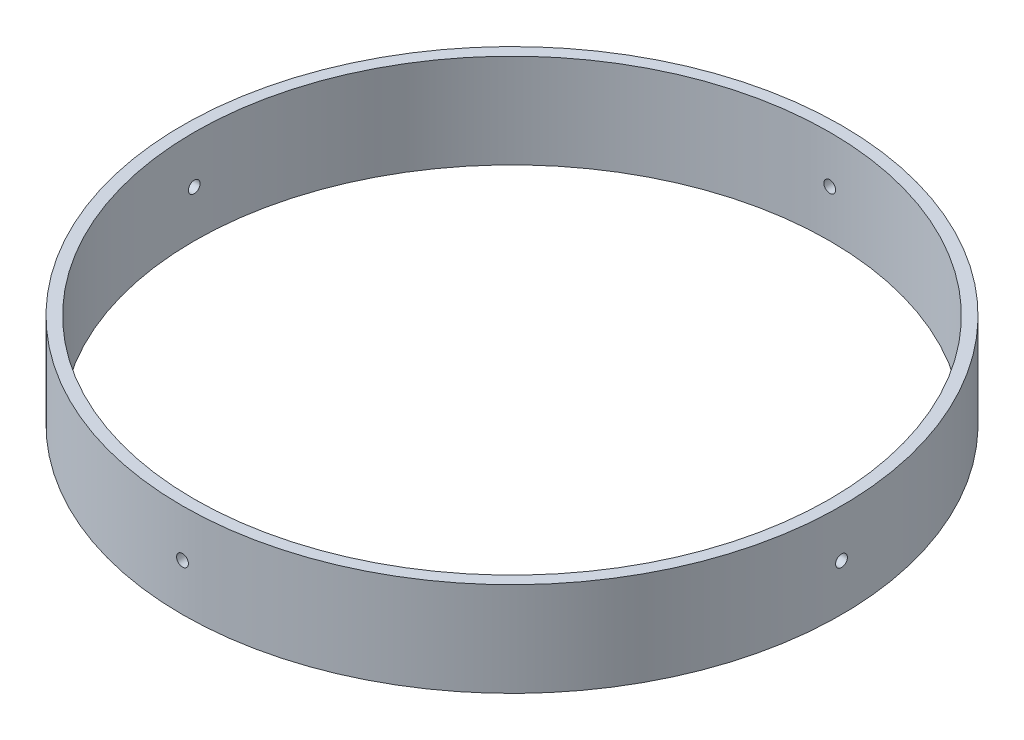
from build123d import *

# Parameters (mm, degrees)
SKETCH1_R               = 88.9
SKETCH1_R_2             = 85.725
BOSS_EXTRUDE1_DEPTH     = 25.4
CUT_EXTRUDE1_DEPTH      = 201.402619743
CUT_EXTRUDE1_DEPTH_BACK = 201.402619743
SKETCH2_R               = 1.5875
CUT_EXTRUDE2_DEPTH      = 201.402619892
CUT_EXTRUDE2_DEPTH_BACK = 201.402619892
SKETCH3_R               = 1.5875


with BuildPart() as part:
    # Sketch1 → Boss-Extrude1 (new body)
    with BuildSketch(Plane(origin=(0, 0, 0), x_dir=(1, 0, 0), z_dir=(0, 1, 0))):
        Circle(SKETCH1_R)
        Circle(SKETCH1_R_2, mode=Mode.SUBTRACT)
    extrude(amount=BOSS_EXTRUDE1_DEPTH)

    # Sketch2 → Cut-Extrude1 (cut, two sides: drawn at the far end of the back side and taken through both)
    with BuildSketch(Plane.XY.offset(88.9).offset(-CUT_EXTRUDE1_DEPTH_BACK)):
        with Locations((0, 12.7)):
            Circle(SKETCH2_R)
    extrude(amount=CUT_EXTRUDE1_DEPTH + CUT_EXTRUDE1_DEPTH_BACK, mode=Mode.SUBTRACT)

    # Sketch3 → Cut-Extrude2 (cut, two sides: drawn at the far end of the back side and taken through both)
    with BuildSketch(Plane(origin=(88.9, 0, 0), x_dir=(0, 0, -1), z_dir=(1, 0, 0)).offset(-CUT_EXTRUDE2_DEPTH_BACK)):
        with Locations((0, 12.598884212)):
            Circle(SKETCH3_R)
    extrude(amount=CUT_EXTRUDE2_DEPTH + CUT_EXTRUDE2_DEPTH_BACK, mode=Mode.SUBTRACT)


solid = part.part
